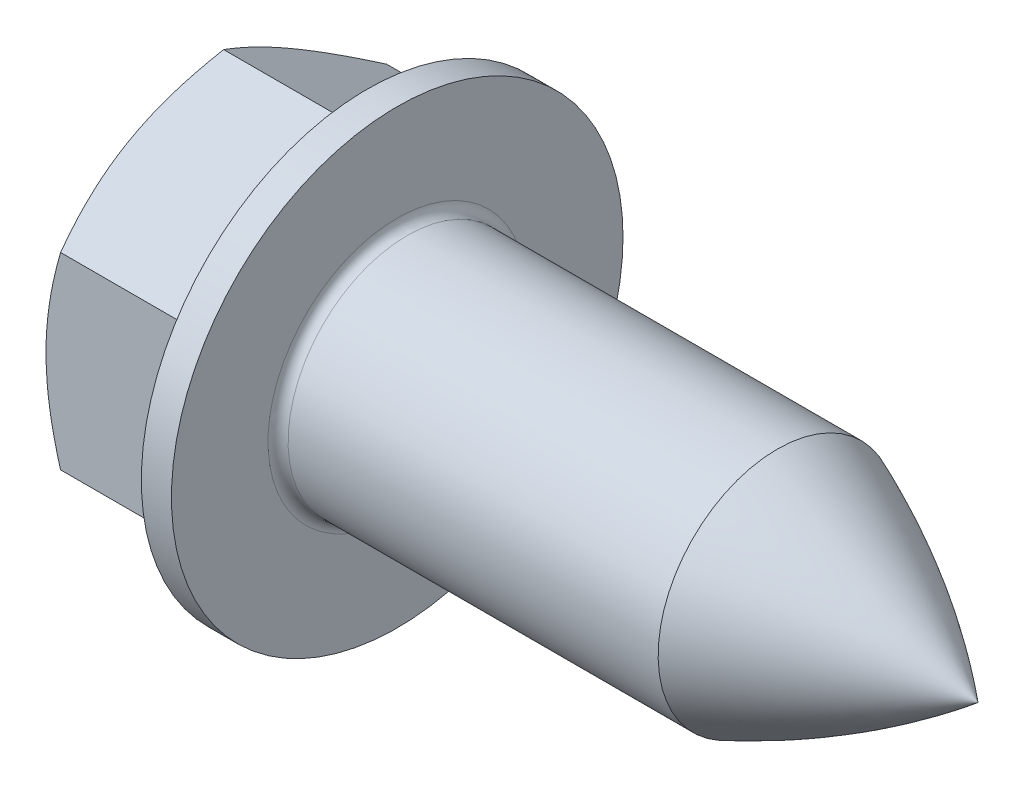
from build123d import *

# Parameters (mm, degrees)
BASEHEAD_DEPTH = 7.5
SKETCH1_W      = 23.15
SKETCH1_H      = 4.75
SKETCH3_R      = 9
NECK_DEPTH     = 1.2
FILLET1_R      = 0.4
FILLET2_R      = 0.6


with BuildPart() as part:
    # Sketch2 → BaseHead (new body)
    with BuildSketch(Plane(origin=(0, 0, 0), x_dir=(0, 0, -1), z_dir=(1, 0, 0))):
        Polygon((0, 7.505553499), (-6.5, 3.75277675), (-6.5, -3.75277675), (0, -7.505553499), (6.5, -3.75277675), (6.5, 3.75277675), align=None)
    extrude(amount=BASEHEAD_DEPTH)

    # Sketch1 → BaseBody (revolve)
    with BuildSketch(Plane.XY):
        with Locations((19.075, 2.375)):
            Rectangle(SKETCH1_W, SKETCH1_H)
    revolve(axis=Axis((-9.544470106, 0, 0), (1, 0, 0)))

    # Sketch3 → Neck (add)
    with BuildSketch(Plane(origin=(7.5, -3.781678926, 4.212711044), x_dir=(0, 0, -1), z_dir=(1, 0, 0))):
        with Locations((4.212711044, 3.781678926)):
            Circle(SKETCH3_R)
    extrude(amount=-NECK_DEPTH)

    # Sketch4 → Cut-Revolve7 (revolve, cut)
    with BuildSketch(Plane.XY):
        Polygon((0, 6.5), (0.580556584, 7.505553499), (0, 7.505553499), align=None)
    revolve(axis=Axis((10.663764742, 0, 0), (-1, 0, 0)), mode=Mode.SUBTRACT)

    # Fillet1
    fillet1_edges = [part.edges().sort_by_distance(p)[0] for p in [
        (7.5, -4.75, 0),
    ]]
    fillet(fillet1_edges, radius=FILLET1_R)

    # Fillet2
    fillet2_edges = [part.edges().sort_by_distance(p)[0] for p in [
        (6.3, -5.629165125, -3.25),
        (6.3, -5.629165125, 3.25),
        (6.3, 0, 6.5),
        (6.3, 5.629165125, 3.25),
        (6.3, 5.629165125, -3.25),
        (6.3, 0, -6.5),
    ]]
    fillet(fillet2_edges, radius=FILLET2_R)

    # Sketch5 → Cut-Revolve1 (revolve, cut)
    with BuildSketch(Plane.XY):
        Polygon((26.45, -4.75), (28.55, -4.75), (30.65, -4.225), (30.65, -5.25), (26.45, -5.25), align=None)
    revolve(axis=Axis((31.978193536, 0, 0), (-1, 0, 0)), mode=Mode.SUBTRACT)

    # Sketch6 → Cut-Revolve6 (revolve, cut)
    with BuildSketch(Plane.XY):
        with BuildLine():
            Line((30.65, 0), (31.15, 0))
            Line((31.15, 0), (31.15, -4.75))
            Line((31.15, -4.75), (30.65, -4.75))
            Line((30.65, -4.75), (22.65, -4.75))
            ThreePointArc((22.65, -4.75), (26.823552739, -2.66729935), (30.65, 0))
        make_face()
    revolve(axis=Axis((33.390663239, 0, 0), (-1, 0, 0)), mode=Mode.SUBTRACT)

    # Sketch7 → Cut-Revolve8 (revolve, cut)
    with BuildSketch(Plane.XY):
        with BuildLine():
            Line((-0.1, 5.416666667), (0.9, 5.416666667))
            ThreePointArc((0.9, 5.416666667), (1.076776695, 5.343443362), (1.15, 5.166666667))
            Line((1.15, 5.166666667), (1.15, 0))
            Line((1.15, 0), (-0.1, 0))
            Line((-0.1, 0), (-0.1, 5.416666667))
        make_face()
    revolve(axis=Axis((0, 0, 0), (-1, 0, 0)), mode=Mode.SUBTRACT)


solid = part.part
